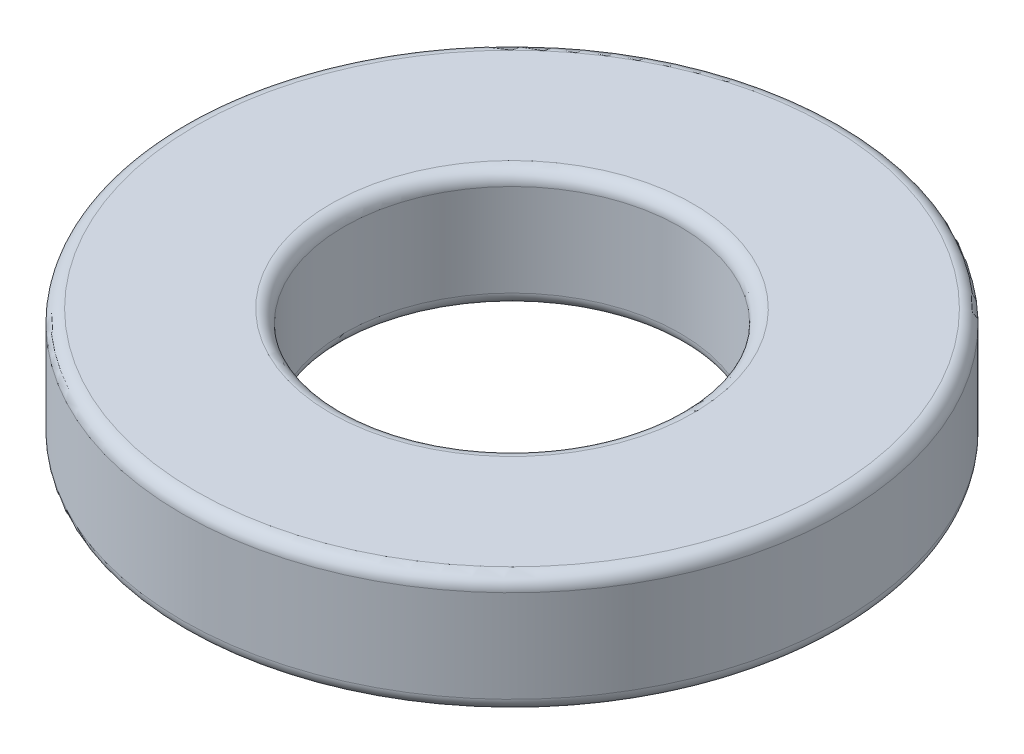
from build123d import *

# Parameters (mm, degrees)
SKETCH1_R           = 25
SKETCH1_R_2         = 12.75
BOSS_EXTRUDE1_DEPTH = 9
FILLET1_R           = 1


with BuildPart() as part:
    # Sketch1 → Boss-Extrude1 (new body)
    with BuildSketch(Plane(origin=(0, 0, 0), x_dir=(1, 0, 0), z_dir=(0, 1, 0))):
        Circle(SKETCH1_R)
        Circle(SKETCH1_R_2, mode=Mode.SUBTRACT)
    extrude(amount=BOSS_EXTRUDE1_DEPTH)

    # Fillet1
    fillet1_edges = [part.edges().sort_by_distance(p)[0] for p in [
        (-25, 0, 0),
        (-25, 9, 0),
        (-12.75, 0, 0),
        (-12.75, 9, 0),
    ]]
    fillet(fillet1_edges, radius=FILLET1_R)


solid = part.part
